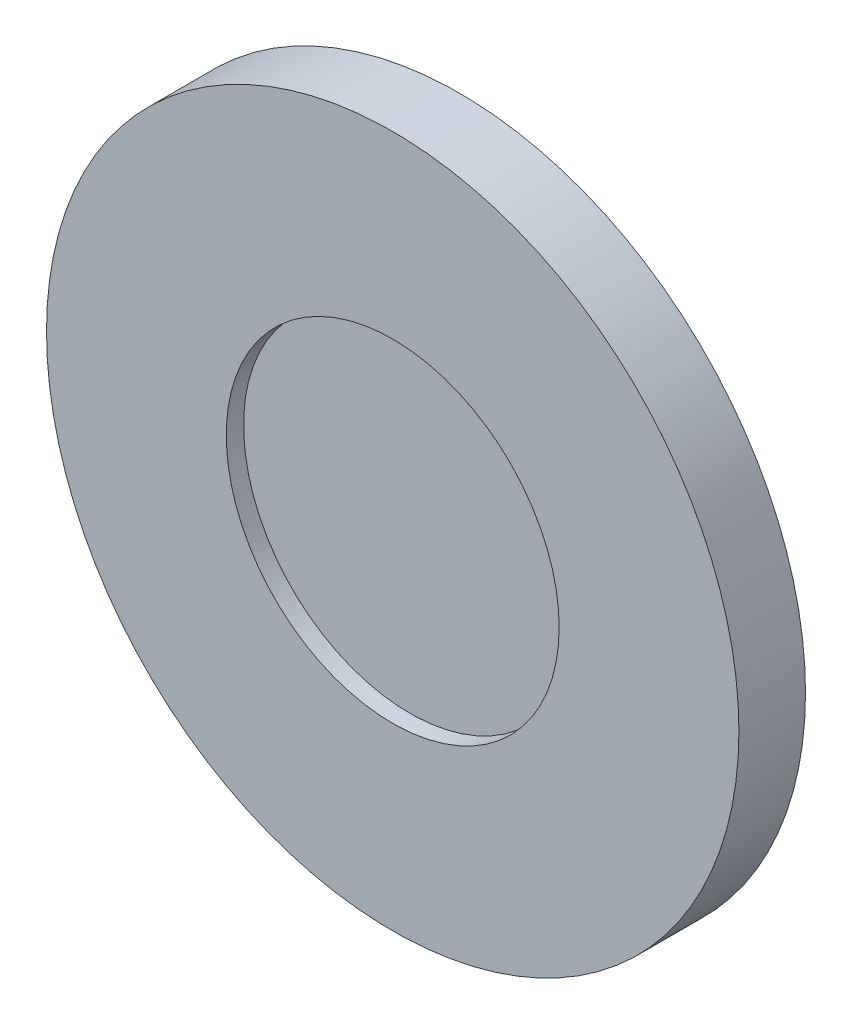
from build123d import *

# Parameters (mm, degrees)
SKETCH_1_R              = 52
F_01_DISC_D104_DEPTH    = 10
F_02_FOOT_1_DEPTH       = 1.2
F_02_FOOT_2_DEPTH       = 1.2
F_02_FOOT_3_DEPTH       = 1.2
SKETCH_5_R              = 25
F_03_RECESS_D50_DEPTH   = 2.6
SKETCH_6_R              = 3.25
F_04_SCREW_SEAT_1_DEPTH = 0.3
SKETCH_7_W              = 6.5
SKETCH_7_H              = 0.7
F_04_SCREW_X_1_1_DEPTH  = 0.45
SKETCH_8_W              = 0.7
SKETCH_8_H              = 6.5
F_04_SCREW_X_1_2_DEPTH  = 0.45
SKETCH_9_R              = 3.25
F_04_SCREW_SEAT_2_DEPTH = 0.3
SKETCH_10_W             = 6.5
SKETCH_10_H             = 0.7
F_04_SCREW_X_2_1_DEPTH  = 0.45
SKETCH_11_W             = 0.7
SKETCH_11_H             = 6.5
F_04_SCREW_X_2_2_DEPTH  = 0.45
SKETCH_12_R             = 3.25
F_04_SCREW_SEAT_3_DEPTH = 0.3
SKETCH_13_W             = 6.5
SKETCH_13_H             = 0.7
F_04_SCREW_X_3_1_DEPTH  = 0.45
SKETCH_14_W             = 0.7
SKETCH_14_H             = 6.5
F_04_SCREW_X_3_2_DEPTH  = 0.45


with BuildPart() as part:
    # 草图1 → 01_DISC_D104 (new body)
    with BuildSketch(Plane.XY):
        Circle(SKETCH_1_R)
    extrude(amount=F_01_DISC_D104_DEPTH)

    # 草图2 → 02_FOOT_1 (add)
    with BuildSketch(Plane.XY):
        with BuildLine():
            Line((27.984398577, 37.136551217), (23.470785903, 31.146784892))
            ThreePointArc((23.470785903, 31.146784892), (33.774990748, 19.5), (38.709299914, 4.752904393))
            Line((38.709299914, 4.752904393), (46.153396051, 5.666924468))
            ThreePointArc((46.153396051, 5.666924468), (40.270181276, 23.25), (27.984398577, 37.136551217))
        make_face()
    extrude(amount=-F_02_FOOT_1_DEPTH)

    # 草图3 → 02_FOOT_2 (add)
    with BuildSketch(Plane.XY):
        with BuildLine():
            Line((-46.153396051, 5.666924468), (-38.709299914, 4.752904393))
            ThreePointArc((-38.709299914, 4.752904393), (-33.774990748, 19.5), (-23.470785903, 31.146784892))
            Line((-23.470785903, 31.146784892), (-27.984398577, 37.136551217))
            ThreePointArc((-27.984398577, 37.136551217), (-40.270181276, 23.25), (-46.153396051, 5.666924468))
        make_face()
    extrude(amount=-F_02_FOOT_2_DEPTH)

    # 草图4 → 02_FOOT_3 (add)
    with BuildSketch(Plane.XY):
        with BuildLine():
            Line((18.168997475, -42.803475686), (15.238514011, -35.899689285))
            ThreePointArc((15.238514011, -35.899689285), (0, -39), (-15.238514011, -35.899689285))
            Line((-15.238514011, -35.899689285), (-18.168997475, -42.803475686))
            ThreePointArc((-18.168997475, -42.803475686), (0, -46.5), (18.168997475, -42.803475686))
        make_face()
    extrude(amount=-F_02_FOOT_3_DEPTH)

    # 草图5 → 03_RECESS_D50 (cut)
    with BuildSketch(Plane.XY.offset(10)):
        Circle(SKETCH_5_R)
    extrude(amount=-F_03_RECESS_D50_DEPTH, mode=Mode.SUBTRACT)

    # 草图6 → 04_SCREW_SEAT_1 (cut)
    with BuildSketch(Plane.XY):
        with Locations((0, 12)):
            Circle(SKETCH_6_R)
    extrude(amount=F_04_SCREW_SEAT_1_DEPTH, mode=Mode.SUBTRACT)

    # 草图7 → 04_SCREW_X_1_1 (cut)
    with BuildSketch(Plane.XY):
        with Locations((0, 12)):
            Rectangle(SKETCH_7_W, SKETCH_7_H)
    extrude(amount=F_04_SCREW_X_1_1_DEPTH, mode=Mode.SUBTRACT)

    # 草图8 → 04_SCREW_X_1_2 (cut)
    with BuildSketch(Plane.XY):
        with Locations((0, 12)):
            Rectangle(SKETCH_8_W, SKETCH_8_H)
    extrude(amount=F_04_SCREW_X_1_2_DEPTH, mode=Mode.SUBTRACT)

    # 草图9 → 04_SCREW_SEAT_2 (cut)
    with BuildSketch(Plane.XY):
        with Locations((-10.392304845, -6)):
            Circle(SKETCH_9_R)
    extrude(amount=F_04_SCREW_SEAT_2_DEPTH, mode=Mode.SUBTRACT)

    # 草图10 → 04_SCREW_X_2_1 (cut)
    with BuildSketch(Plane.XY):
        with Locations((-10.392304845, -6)):
            Rectangle(SKETCH_10_W, SKETCH_10_H)
    extrude(amount=F_04_SCREW_X_2_1_DEPTH, mode=Mode.SUBTRACT)

    # 草图11 → 04_SCREW_X_2_2 (cut)
    with BuildSketch(Plane.XY):
        with Locations((-10.392304845, -6)):
            Rectangle(SKETCH_11_W, SKETCH_11_H)
    extrude(amount=F_04_SCREW_X_2_2_DEPTH, mode=Mode.SUBTRACT)

    # 草图12 → 04_SCREW_SEAT_3 (cut)
    with BuildSketch(Plane.XY):
        with Locations((10.392304845, -6)):
            Circle(SKETCH_12_R)
    extrude(amount=F_04_SCREW_SEAT_3_DEPTH, mode=Mode.SUBTRACT)

    # 草图13 → 04_SCREW_X_3_1 (cut)
    with BuildSketch(Plane.XY):
        with Locations((10.392304845, -6)):
            Rectangle(SKETCH_13_W, SKETCH_13_H)
    extrude(amount=F_04_SCREW_X_3_1_DEPTH, mode=Mode.SUBTRACT)

    # 草图14 → 04_SCREW_X_3_2 (cut)
    with BuildSketch(Plane.XY):
        with Locations((10.392304845, -6)):
            Rectangle(SKETCH_14_W, SKETCH_14_H)
    extrude(amount=F_04_SCREW_X_3_2_DEPTH, mode=Mode.SUBTRACT)


solid = part.part
